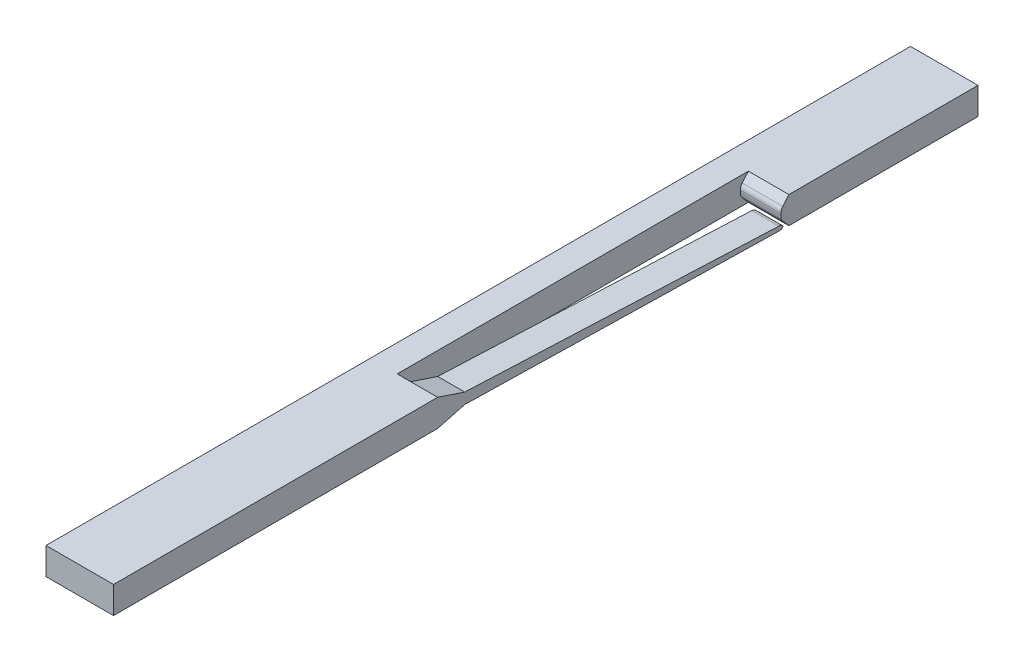
from build123d import *

# Parameters (mm, degrees)
SKETCH1_W           = 203.2
SKETCH1_H           = 6.35
BOSS_EXTRUDE1_DEPTH = 6.35
SKETCH2_W           = 76.2
SKETCH2_H           = 6.35
SKETCH2_W_2         = 44.45
BOSS_EXTRUDE2_DEPTH = 9.525
BOSS_EXTRUDE3_REACH = 205.918
BOSS_EXTRUDE4_DEPTH = 6.35
FILLET1_R           = 1.905


with BuildPart() as part:
    # Sketch1 → Boss-Extrude1 (new body)
    with BuildSketch(Plane(origin=(0, 0, 0), x_dir=(0, 0, -1), z_dir=(1, 0, 0))):
        with Locations((101.6, 3.175)):
            Rectangle(SKETCH1_W, SKETCH1_H)
    extrude(amount=-BOSS_EXTRUDE1_DEPTH)

    # Sketch2 → Boss-Extrude2 (add)
    with BuildSketch(Plane(origin=(0, 0, 0), x_dir=(0, 0, -1), z_dir=(1, 0, 0))):
        with Locations((38.1, 3.175)):
            Rectangle(SKETCH2_W, SKETCH2_H)
        with Locations((180.975, 3.175)):
            Rectangle(SKETCH2_W_2, SKETCH2_H)
    extrude(amount=BOSS_EXTRUDE2_DEPTH)

    # Sketch4 → Boss-Extrude3 (add, up to next)
    with BuildSketch(Plane(origin=(9.525, 0, 0), x_dir=(0, 0, -1), z_dir=(1, 0, 0)), mode=Mode.PRIVATE) as boss_extrude3_sk1:
        Polygon((158.75, 6.35), (158.75, 0), (156.845, 2.2225), (156.845, 4.1275), align=None)
    boss_extrude3_tool1 = extrude(boss_extrude3_sk1.sketch, amount=-BOSS_EXTRUDE3_REACH, mode=Mode.PRIVATE) - part.part
    add(boss_extrude3_tool1.solids().sort_by_distance((9.525, 3.175, -157.968462))[0])

    # Sketch5 → Boss-Extrude4 (add)
    with BuildSketch(Plane(origin=(9.525, 0, 0), x_dir=(0, 0, -1), z_dir=(1, 0, 0))):
        with BuildLine():
            add(Edge.make_bspline(
                [(156.352355413, 0.078645489), (157.304855413, 0.047889619), (157.32125, 0.555625)],
                knots=[1.570796327, 1.570796327, 1.570796327, 3.141592654, 3.141592654, 3.141592654], degree=2, weights=[1, 0.707106781, 1]))
            add(Edge.make_bspline(
                [(157.32125, 0.555625), (157.337644587, 1.063360381), (156.385144587, 1.094116252)],
                knots=[3.141592654, 3.141592654, 3.141592654, 4.71238898, 4.71238898, 4.71238898], degree=2, weights=[1, 0.707106781, 1]))
            Line((156.385144587, 1.094116252), (82.55, 4.239960861))
            Line((82.55, 4.239960861), (76.2, 6.35))
            Line((76.2, 6.35), (76.2, 0))
            Line((76.2, 0), (82.55, 1.699960861))
            Line((82.55, 1.699960861), (156.352355413, 0.078645489))
        make_face()
    extrude(amount=-BOSS_EXTRUDE4_DEPTH)

    # Fillet1
    fillet1_edges = [part.edges().sort_by_distance(p)[0] for p in [
        (4.7625, 4.1275, -156.845),
        (4.7625, 2.2225, -156.845),
    ]]
    fillet(fillet1_edges, radius=FILLET1_R)


solid = part.part
